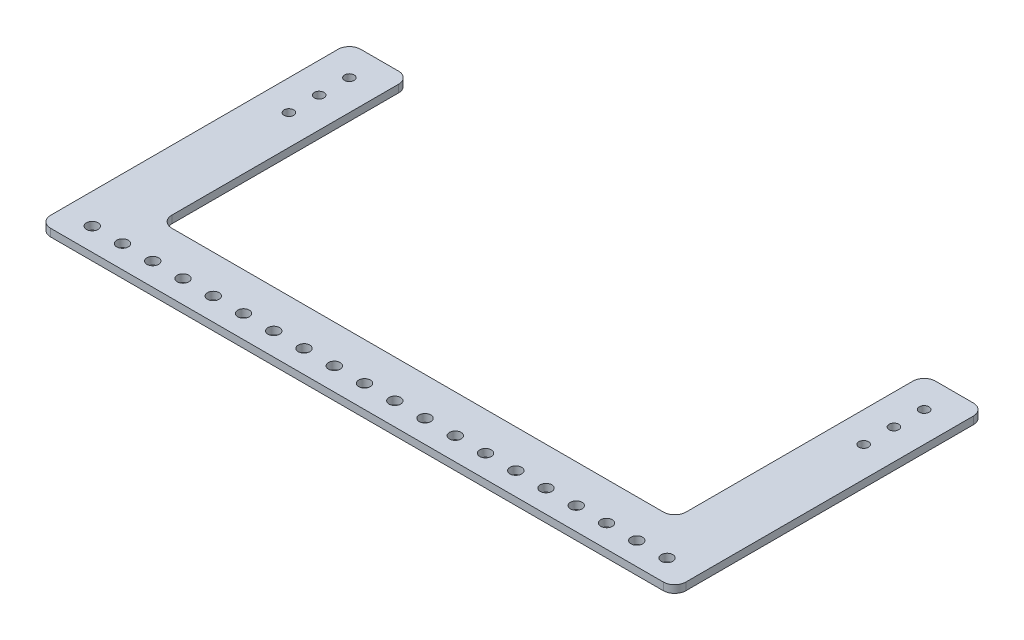
from build123d import *

# Parameters (mm, degrees)
SKETCH2_R           = 2.0193
BOSS_EXTRUDE1_DEPTH = 3.175
FILLET1_R           = 4.7625
SKETCH3_R           = 2.4384
CUT_EXTRUDE1_DEPTH  = 149.42063799


with BuildPart() as part:
    # Sketch2 → Boss-Extrude1 (new body)
    with BuildSketch(Plane(origin=(0, 0, 0), x_dir=(1, 0, 0), z_dir=(0, 1, 0))):
        Polygon((-133.35, 65.0875), (-133.35, -65.0875), (133.35, -65.0875), (133.35, 65.0875), (107.95, 65.0875), (107.95, -39.624), (-107.95, -39.624), (-107.95, 65.0875), align=None)
        with Locations((-120.65, 26.9875)):
            Circle(SKETCH2_R, mode=Mode.SUBTRACT)
        with Locations((-120.65, 39.6875)):
            Circle(SKETCH2_R, mode=Mode.SUBTRACT)
        with Locations((-120.65, 52.3875)):
            Circle(SKETCH2_R, mode=Mode.SUBTRACT)
        with Locations((120.65, 26.9875)):
            Circle(SKETCH2_R, mode=Mode.SUBTRACT)
        with Locations((120.65, 39.6875)):
            Circle(SKETCH2_R, mode=Mode.SUBTRACT)
        with Locations((120.65, 52.3875)):
            Circle(SKETCH2_R, mode=Mode.SUBTRACT)
    extrude(amount=BOSS_EXTRUDE1_DEPTH)

    # Fillet1
    fillet1_edges = [part.edges().sort_by_distance(p)[0] for p in [
        (133.35, 1.5875, -65.0875),
        (-133.35, 1.5875, 65.0875),
        (-133.35, 1.5875, -65.0875),
        (-107.95, 1.5875, -65.0875),
        (-107.95, 1.5875, 39.624),
        (107.95, 1.5875, 39.624),
        (107.95, 1.5875, -65.0875),
        (133.35, 1.5875, 65.0875),
    ]]
    fillet(fillet1_edges, radius=FILLET1_R)

    # Sketch3 → Cut-Extrude1 (cut, through all)
    with BuildSketch(Plane(origin=(0, 3.175, 0), x_dir=(1, 0, 0), z_dir=(0, 1, 0))):
        with Locations((-120.65, -55.5625)):
            Circle(SKETCH3_R)
        with Locations((-107.95, -55.5625)):
            Circle(SKETCH3_R)
        with Locations((-95.25, -55.5625)):
            Circle(SKETCH3_R)
        with Locations((-82.55, -55.5625)):
            Circle(SKETCH3_R)
        with Locations((-69.85, -55.5625)):
            Circle(SKETCH3_R)
        with Locations((-57.15, -55.5625)):
            Circle(SKETCH3_R)
        with Locations((-44.45, -55.5625)):
            Circle(SKETCH3_R)
        with Locations((-31.75, -55.5625)):
            Circle(SKETCH3_R)
        with Locations((-19.05, -55.5625)):
            Circle(SKETCH3_R)
        with Locations((-6.35, -55.5625)):
            Circle(SKETCH3_R)
        with Locations((6.35, -55.5625)):
            Circle(SKETCH3_R)
        with Locations((19.05, -55.5625)):
            Circle(SKETCH3_R)
        with Locations((31.75, -55.5625)):
            Circle(SKETCH3_R)
        with Locations((44.45, -55.5625)):
            Circle(SKETCH3_R)
        with Locations((57.15, -55.5625)):
            Circle(SKETCH3_R)
        with Locations((69.85, -55.5625)):
            Circle(SKETCH3_R)
        with Locations((82.55, -55.5625)):
            Circle(SKETCH3_R)
        with Locations((95.25, -55.5625)):
            Circle(SKETCH3_R)
        with Locations((107.95, -55.5625)):
            Circle(SKETCH3_R)
        with Locations((120.65, -55.5625)):
            Circle(SKETCH3_R)
    extrude(amount=-CUT_EXTRUDE1_DEPTH, mode=Mode.SUBTRACT)


solid = part.part
